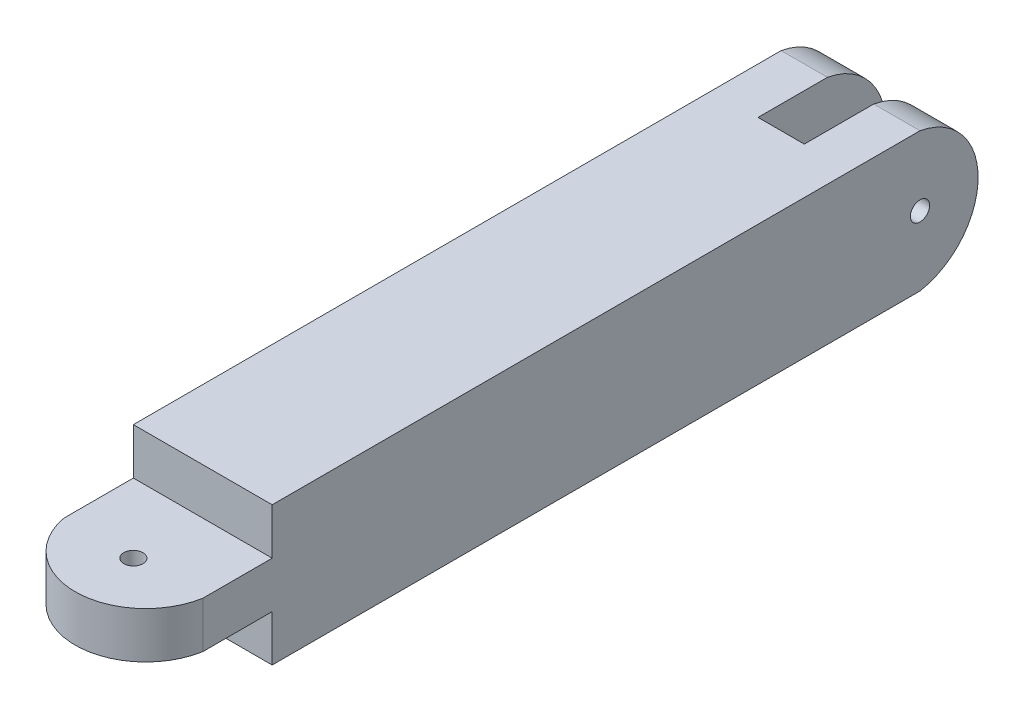
from build123d import *

# Parameters (mm, degrees)
SKETCH2_W               = 60
SKETCH2_H               = 60
BOSS_EXTRUDE1_DEPTH     = 250
SKETCH3_W               = 20
SKETCH3_H               = 60
BOSS_EXTRUDE2_DEPTH     = 30
BOSS_EXTRUDE3_DEPTH     = 20
BOSS_EXTRUDE4_START     = -20
BOSS_EXTRUDE4_DEPTH     = 20
SKETCH6_W               = 60
SKETCH6_H               = 20
BOSS_EXTRUDE5_DEPTH     = 30
BOSS_EXTRUDE6_DEPTH     = 20
CUT_EXTRUDE2_DEPTH      = 5
CUT_EXTRUDE2_DEPTH_BACK = 130
CUT_EXTRUDE2_START      = -10
SKETCH8_W               = 50.5
SKETCH8_H               = 50.5
SKETCH9_R               = 4.15
CUT_EXTRUDE3_DEPTH      = 130
SKETCH11_R              = 4.15
CUT_EXTRUDE4_DEPTH      = 310.208235142
SKETCH12_R              = 4.15
CUT_EXTRUDE5_DEPTH      = 310.208235142


with BuildPart() as part:
    # Sketch2 → Boss-Extrude1 (new body)
    with BuildSketch(Plane.XY):
        Rectangle(SKETCH2_W, SKETCH2_H)
    extrude(amount=BOSS_EXTRUDE1_DEPTH)

    # Sketch3 → Boss-Extrude2 (add)
    with BuildSketch(Plane(origin=(0, 0, 0), x_dir=(-1, 0, 0), z_dir=(0, 0, -1))):
        with Locations((20, 0)):
            Rectangle(SKETCH3_W, SKETCH3_H)
        with Locations((-20, 0)):
            Rectangle(SKETCH3_W, SKETCH3_H)
    extrude(amount=BOSS_EXTRUDE2_DEPTH)

    # Sketch4 → Boss-Extrude3 (add)
    with BuildSketch(Plane(origin=(30, 0, 0), x_dir=(0, 0, -1), z_dir=(1, 0, 0))):
        with BuildLine():
            Line((30, 30), (30, -30))
            ThreePointArc((30, -30), (55.138874415, 0), (30, 30))
        make_face()
    extrude(amount=-BOSS_EXTRUDE3_DEPTH)

    # Sketch5 → Boss-Extrude4 (add)
    with BuildSketch(Plane.ZY.offset(30).offset(BOSS_EXTRUDE4_START)):
        with BuildLine():
            Line((-30, -30), (-30, 30))
            ThreePointArc((-30, 30), (-55.138874415, 0), (-30, -30))
        make_face()
    extrude(amount=BOSS_EXTRUDE4_DEPTH)

    # Sketch6 → Boss-Extrude5 (add)
    with BuildSketch(Plane.XY.offset(250)):
        Rectangle(SKETCH6_W, SKETCH6_H)
    extrude(amount=BOSS_EXTRUDE5_DEPTH)

    # Sketch7 → Boss-Extrude6 (add)
    with BuildSketch(Plane(origin=(0, 10, 0), x_dir=(1, 0, 0), z_dir=(0, 1, 0))):
        with BuildLine():
            Line((30, -280), (-30, -280))
            ThreePointArc((-30, -280), (0, -305.138874415), (30, -280))
        make_face()
    extrude(amount=-BOSS_EXTRUDE6_DEPTH)

    # Sketch8 → Cut-Extrude2 (cut, two sides: drawn at the far end of the back side and taken through both)
    with BuildSketch(Plane.XY.offset(250).offset(CUT_EXTRUDE2_START - CUT_EXTRUDE2_DEPTH_BACK)):
        Rectangle(SKETCH8_W, SKETCH8_H)
    extrude(amount=CUT_EXTRUDE2_DEPTH + CUT_EXTRUDE2_DEPTH_BACK, mode=Mode.SUBTRACT)

    # Sketch9 → Cut-Extrude3 (cut)
    with BuildSketch(Plane(origin=(0, -10, 0), x_dir=(-1, 0, 0), z_dir=(0, -1, 0))):
        with Locations((0, -280)):
            Circle(SKETCH9_R)
    extrude(amount=-CUT_EXTRUDE3_DEPTH, mode=Mode.SUBTRACT)

    # Sketch11 → Cut-Extrude4 (cut, through all)
    with BuildSketch(Plane.ZY.offset(-10)):
        with Locations((-30, 0)):
            Circle(SKETCH11_R)
    extrude(amount=-CUT_EXTRUDE4_DEPTH, mode=Mode.SUBTRACT)

    # Sketch12 → Cut-Extrude5 (cut, through all)
    with BuildSketch(Plane(origin=(-10, 0, 0), x_dir=(0, 0, -1), z_dir=(1, 0, 0))):
        with Locations((30, 0)):
            Circle(SKETCH12_R)
    extrude(amount=-CUT_EXTRUDE5_DEPTH, mode=Mode.SUBTRACT)


solid = part.part
